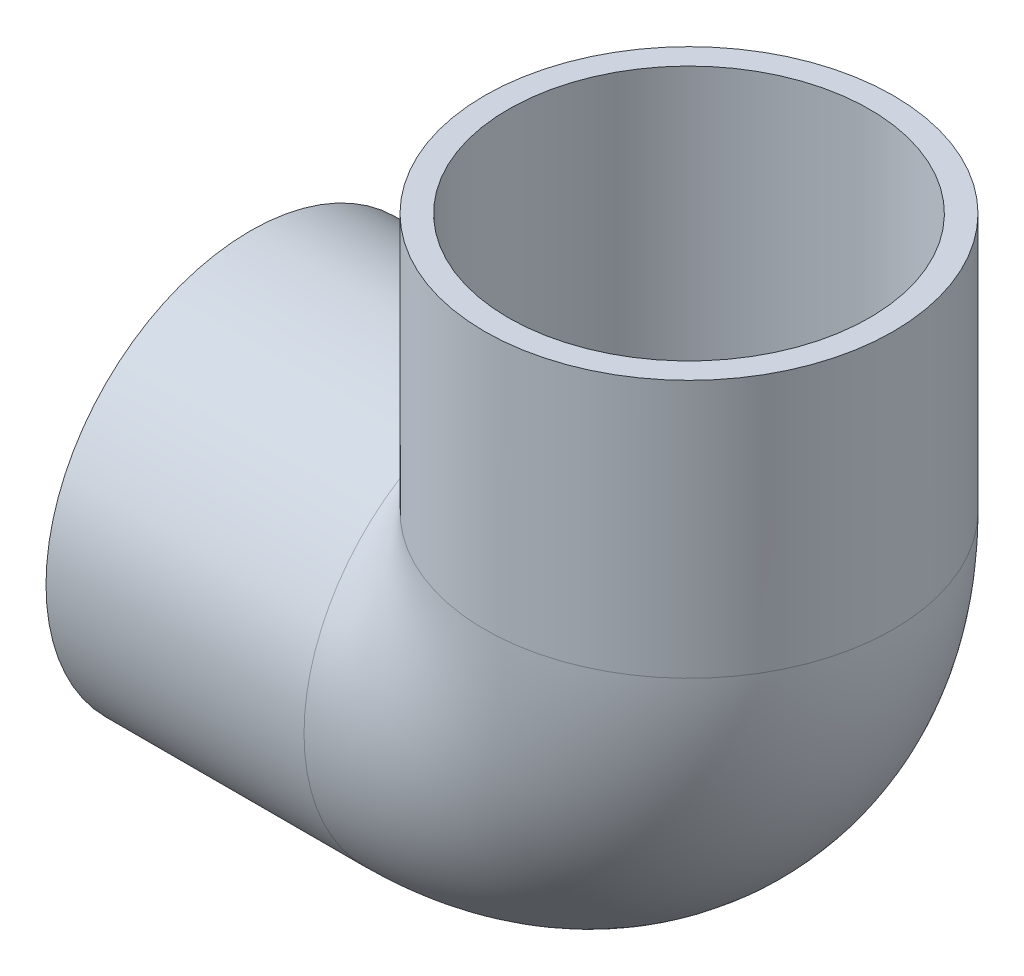
from build123d import *

# Parameters (mm, degrees)
SKETCH3_R          = 25.146
SKETCH3_R_2        = 17.526
SKETCH5_R          = 22.225
CUT_EXTRUDE1_DEPTH = 31.75


with BuildPart() as part:
    # Sketch1 → Revolve1 (revolve)
    with BuildSketch(Plane.XY):
        Polygon((-53.975, -25.146), (-22.225, -25.146), (-22.225, -21.0185), (-53.975, -21.209), align=None)
    revolve(axis=Axis((-53.975, 0, 0), (1, 0, 0)))


with BuildPart() as body_2:
    # Sketch2 → Revolve2 (revolve)
    with BuildSketch(Plane.XY):
        Polygon((21.209, 53.975), (21.0185, 22.225), (25.146, 22.225), (25.146, 53.975), align=None)
    revolve(axis=Axis((0, 0, 0), (0, 1, 0)))


with BuildPart() as sweep1_tool:
    # Sweep1: sweep along a path in Sketch4
    with BuildLine(Plane.XY) as sweep1_path:
        ThreePointArc((-22.225, 0), (-6.509552, 6.509552), (0, 22.225))
    # Sketch3 → Sweep1 (sweep)
    with BuildSketch(Plane(origin=(-22.225, 0, 0), x_dir=(0, 0, -1), z_dir=(1, 0, 0))):
        Circle(SKETCH3_R)
        Circle(SKETCH3_R_2, mode=Mode.SUBTRACT)
    sweep(path=sweep1_path.line)


with BuildPart() as part_1:
    add(part.part)


with BuildPart() as part_2:
    # Sweep1: joined with sweep1_tool
    add(part_1.part.fuse(sweep1_tool.part, body_2.part, tol=0.00001))

    # Sketch5 → Cut-Extrude1 (cut)
    with BuildSketch(Plane(origin=(0, 53.975, 0), x_dir=(1, 0, 0), z_dir=(0, 1, 0))):
        Circle(SKETCH5_R)
    extrude(amount=-CUT_EXTRUDE1_DEPTH, mode=Mode.SUBTRACT)


solid = part_2.part
